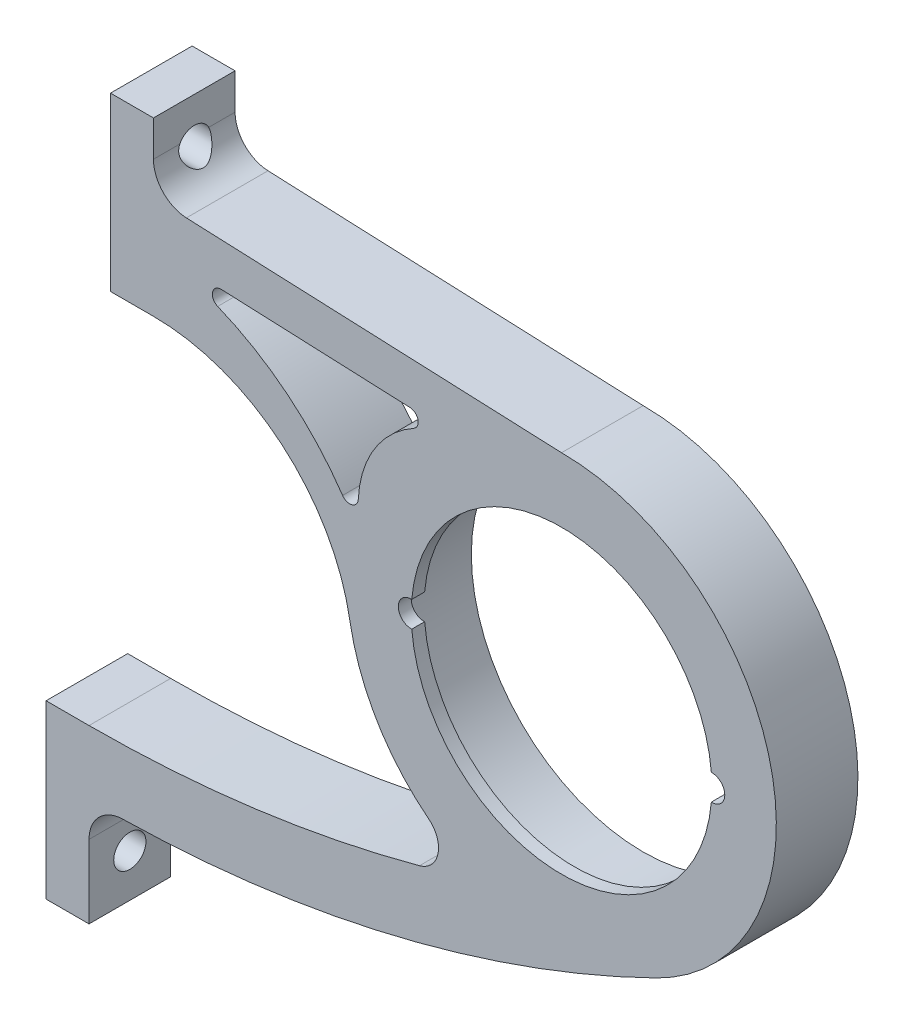
from build123d import *

# Parameters (mm, degrees)
SKETCH1_R           = 50.8
BOSS_EXTRUDE1_DEPTH = 24.13
FILLET1_R           = 10.16
FILLET2_R           = 2.54
FILLET3_R           = 7.62
SKETCH2_R           = 4.7625
CUT_EXTRUDE1_DEPTH  = 252.642737
BOSS_EXTRUDE2_START = -3.81
SKETCH3_R           = 50.8
BOSS_EXTRUDE2_DEPTH = 3.81


with BuildPart() as part:
    # Sketch1 → Boss-Extrude1 (new body)
    with BuildSketch(Plane.XY):
        with BuildLine():
            Line((-133.35, 88.9), (-133.35, 38.1))
            Line((-133.35, 38.1), (-120.65, 38.1))
            ThreePointArc((-120.65, 38.1), (-82.687256, 24.244821), (-62.573744, -10.806321))
            ThreePointArc((-62.573744, -10.806321), (-49.896342, -39.276011), (-25.200511, -58.285369))
            ThreePointArc((-25.200511, -58.285369), (-81.75376, -71.694263), (-139.7, -76.2))
            Line((-139.7, -76.2), (-152.4, -76.2))
            Line((-152.4, -76.2), (-152.4, -127))
            Line((-152.4, -127), (-139.7, -127))
            Line((-139.7, -127), (-139.7, -95.25))
            ThreePointArc((-139.7, -95.25), (-53.658629, -85.877954), (27.94, -57.022859))
            ThreePointArc((27.94, -57.022859), (61.859524, 14.340476), (0, 63.5))
            Line((0, 63.5), (-120.65, 68.58))
            Line((-120.65, 68.58), (-120.65, 88.9))
            Line((-120.65, 88.9), (-133.35, 88.9))
        make_face()
        Circle(SKETCH1_R, mode=Mode.SUBTRACT)
        with BuildLine():
            Line((-26.787302, 51.916634), (-129.54, 56.243063))
            ThreePointArc((-129.54, 56.243063), (-86.447642, 41.940834), (-57.421084, 7.027169))
            ThreePointArc((-57.421084, 7.027169), (-54.571217, 37.979735), (-26.787302, 51.916634))
        make_face(mode=Mode.SUBTRACT)
    extrude(amount=BOSS_EXTRUDE1_DEPTH)

    # Fillet1
    fillet1_edges = [part.edges().sort_by_distance(p)[0] for p in [
        (-139.7, -95.25, 12.065),
        (-120.65, 68.58, 12.065),
    ]]
    fillet(fillet1_edges, radius=FILLET1_R)

    # Fillet2
    fillet2_edges = [part.edges().sort_by_distance(p)[0] for p in [
        (-57.421084, 7.027169, 12.065),
        (-26.787302, 51.916634, 12.065),
        (-129.54, 56.243063, 12.065),
    ]]
    fillet(fillet2_edges, radius=FILLET2_R)

    # Fillet3
    fillet3_edges = [part.edges().sort_by_distance(p)[0] for p in [
        (-25.200511, -58.285369, 12.065),
    ]]
    fillet(fillet3_edges, radius=FILLET3_R)

    # Sketch2 → Cut-Extrude1 (cut, through all)
    with BuildSketch(Plane.ZY.offset(152.4)):
        with Locations((12.065, -114.3)):
            Circle(SKETCH2_R)
        with Locations((12.065, 76.2)):
            Circle(SKETCH2_R)
    extrude(amount=-CUT_EXTRUDE1_DEPTH, mode=Mode.SUBTRACT)

    # Sketch3 → Boss-Extrude2 (add)
    with BuildSketch(Plane.XY.offset(24.13).offset(BOSS_EXTRUDE2_START)):
        Circle(SKETCH3_R)
        with BuildLine():
            ThreePointArc((-44.286714, -3.806499), (0, -44.45), (44.286714, -3.806499))
            ThreePointArc((44.286714, -3.806499), (48.26, 0), (44.286714, 3.806499))
            ThreePointArc((44.286714, 3.806499), (0, 44.45), (-44.286714, 3.806499))
            ThreePointArc((-44.286714, 3.806499), (-48.26, 0), (-44.286714, -3.806499))
        make_face(mode=Mode.SUBTRACT)
    extrude(amount=BOSS_EXTRUDE2_DEPTH)


solid = part.part
